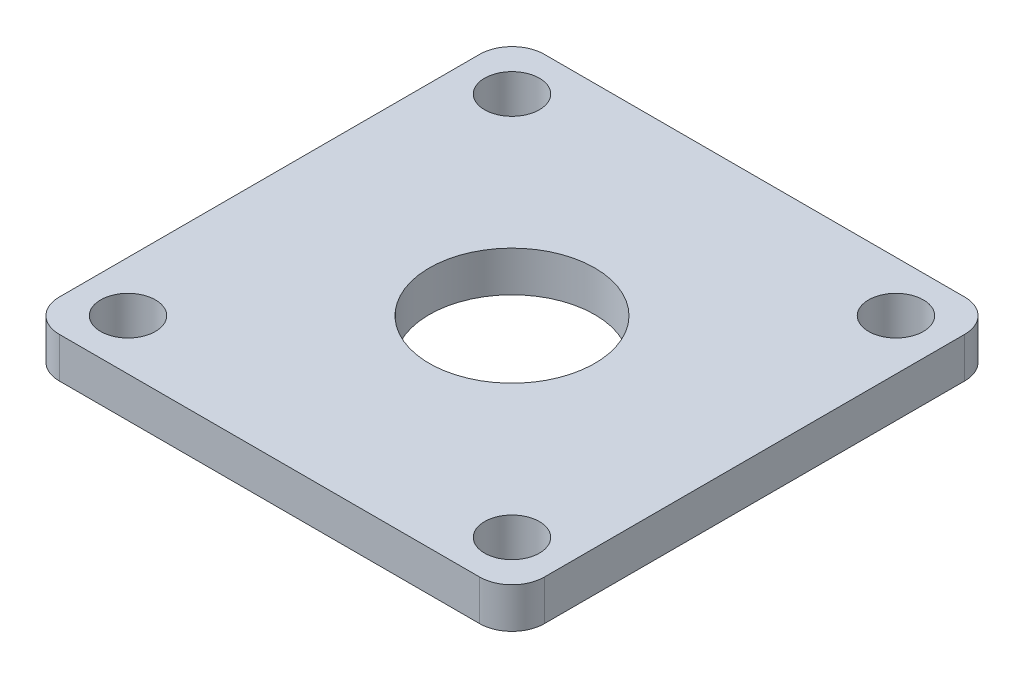
from build123d import *

# Parameters (mm, degrees)
SKETCH1_W           = 38.1
SKETCH1_H           = 38.1
SKETCH1_R           = 1.25
SKETCH1_R_2         = 1.5875
SKETCH1_R_3         = 4
BOSS_EXTRUDE1_DEPTH = 3.175
SKETCH4_R           = 1.7272
CUT_EXTRUDE2_DEPTH  = 9.525
SKETCH7_R           = 2.15265
CUT_EXTRUDE3_DEPTH  = 28.679008291
CIRPATTERN1_COUNT   = 4
SKETCH6_W           = 38.1
SKETCH6_H           = 38.1
SKETCH6_R           = 6.5
SKETCH6_R_2         = 2.15265
BOSS_EXTRUDE2_DEPTH = 3.175
FILLET1_R           = 2.54
FILLET2_R           = 2.54


with BuildPart() as part:
    # Sketch1 → Boss-Extrude1 (new, symmetric)
    with BuildSketch(Plane(origin=(0, 0, 0), x_dir=(1, 0, 0), z_dir=(0, 1, 0))):
        Rectangle(SKETCH1_W, SKETCH1_H)
        with Locations((0, -14)):
            Circle(SKETCH1_R, mode=Mode.SUBTRACT)
        with Locations((-8.838834765, -8.838834765)):
            Circle(SKETCH1_R_2, mode=Mode.SUBTRACT)
        with Locations((8.838834765, -8.838834765)):
            Circle(SKETCH1_R_2, mode=Mode.SUBTRACT)
        with Locations((-14, 0)):
            Circle(SKETCH1_R, mode=Mode.SUBTRACT)
        Circle(SKETCH1_R_3, mode=Mode.SUBTRACT)
        with Locations((-8.838834765, 8.838834765)):
            Circle(SKETCH1_R_2, mode=Mode.SUBTRACT)
        with Locations((0, 14)):
            Circle(SKETCH1_R, mode=Mode.SUBTRACT)
        with Locations((8.838834765, 8.838834765)):
            Circle(SKETCH1_R_2, mode=Mode.SUBTRACT)
        with Locations((14, 0)):
            Circle(SKETCH1_R, mode=Mode.SUBTRACT)
    extrude(amount=BOSS_EXTRUDE1_DEPTH, both=True)

    # Sketch4 → Cut-Extrude2 (cut)
    with BuildSketch(Plane.XY.offset(19.05)):
        with Locations((-5.55625, 0)):
            Circle(SKETCH4_R)
        with Locations((5.55625, 0)):
            Circle(SKETCH4_R)
    cut_extrude2 = extrude(amount=-CUT_EXTRUDE2_DEPTH, mode=Mode.SUBTRACT)

    # Sketch7 → Cut-Extrude3 (cut, through all)
    with BuildSketch(Plane.XZ.offset(3.175)):
        with Locations((-15.08125, 15.08125)):
            Circle(SKETCH7_R)
        with Locations((15.08125, 15.08125)):
            Circle(SKETCH7_R)
        with Locations((15.08125, -15.08125)):
            Circle(SKETCH7_R)
        with Locations((-15.08125, -15.08125)):
            Circle(SKETCH7_R)
    extrude(amount=-CUT_EXTRUDE3_DEPTH, mode=Mode.SUBTRACT)

    # CirPattern1: Cut-Extrude2 ×4 about axis
    cirpattern1_axis = Axis((0, 3.175, 0), (0, -1, 0))
    for i in range(1, CIRPATTERN1_COUNT):
        add(cut_extrude2.rotate(cirpattern1_axis, i * 360 / CIRPATTERN1_COUNT), mode=Mode.SUBTRACT)

    # Fillet1
    fillet1_edges = [part.edges().sort_by_distance(p)[0] for p in [
        (-19.05, 0, 19.05),
        (-19.05, 0, -19.05),
        (19.05, 0, -19.05),
        (19.05, 0, 19.05),
    ]]
    fillet(fillet1_edges, radius=FILLET1_R)


with BuildPart() as body_2:
    # Sketch6 → Boss-Extrude2 (new body)
    with BuildSketch(Plane(origin=(0, -33.3502, 0), x_dir=(-1, 0, 0), z_dir=(0, -1, 0))):
        Rectangle(SKETCH6_W, SKETCH6_H)
        Circle(SKETCH6_R, mode=Mode.SUBTRACT)
        with Locations((-15.08125, 15.08125)):
            Circle(SKETCH6_R_2, mode=Mode.SUBTRACT)
        with Locations((15.08125, 15.08125)):
            Circle(SKETCH6_R_2, mode=Mode.SUBTRACT)
        with Locations((15.08125, -15.08125)):
            Circle(SKETCH6_R_2, mode=Mode.SUBTRACT)
        with Locations((-15.08125, -15.08125)):
            Circle(SKETCH6_R_2, mode=Mode.SUBTRACT)
    extrude(amount=BOSS_EXTRUDE2_DEPTH)

    # Fillet2
    fillet2_edges = [body_2.edges().sort_by_distance(p)[0] for p in [
        (-19.05, -34.9377, 19.05),
        (-19.05, -34.9377, -19.05),
        (19.05, -34.9377, -19.05),
        (19.05, -34.9377, 19.05),
    ]]
    fillet(fillet2_edges, radius=FILLET2_R)


solid = body_2.part
